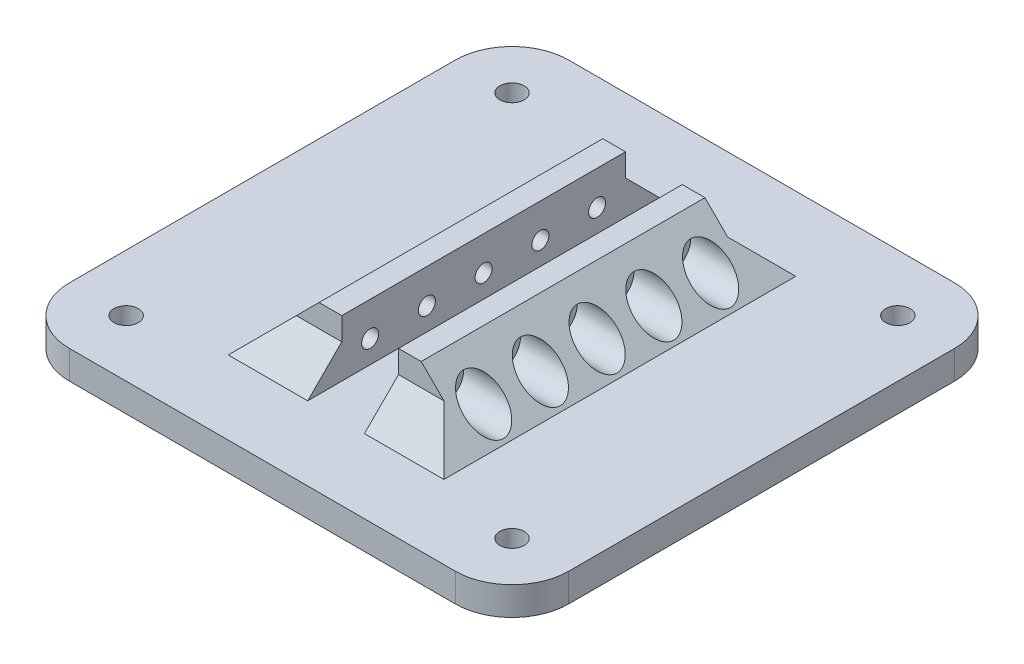
from build123d import *

# Parameters (mm, degrees)
SKETCH1_W           = 88
SKETCH1_H           = 88
BOSS_EXTRUDE1_DEPTH = 5
FILLET1_R           = 10
SKETCH2_R           = 2.15
CUT_EXTRUDE1_DEPTH  = 63.42595614
SKETCH3_W           = 4
SKETCH3_H           = 50
BOSS_EXTRUDE2_DEPTH = 10
CHAMFER1_SIZE       = 10
SKETCH4_R           = 1.5
CUT_EXTRUDE2_DEPTH  = 65.007812023
SKETCH5_R           = 3.5
CUT_EXTRUDE3_DEPTH  = 36
CUT_EXTRUDE4_START  = -36
SKETCH6_R           = 3.5
CUT_EXTRUDE4_DEPTH  = 36
LPATTERN2_COUNT     = 5
LPATTERN2_PITCH     = 10
CHAMFER2_SIZE       = 6


with BuildPart() as part:
    # Sketch1 → Boss-Extrude1 (new body)
    with BuildSketch(Plane(origin=(0, 0, 0), x_dir=(1, 0, 0), z_dir=(0, 1, 0))):
        Rectangle(SKETCH1_W, SKETCH1_H)
    extrude(amount=BOSS_EXTRUDE1_DEPTH)

    # Fillet1
    fillet1_edges = [part.edges().sort_by_distance(p)[0] for p in [
        (-44, 2.5, -44),
        (44, 2.5, -44),
        (44, 2.5, 44),
        (-44, 2.5, 44),
    ]]
    fillet(fillet1_edges, radius=FILLET1_R)

    # Sketch2 → Cut-Extrude1 (cut, through all)
    with BuildSketch(Plane(origin=(0, 5, 0), x_dir=(1, 0, 0), z_dir=(0, 1, 0))):
        with Locations(Location((34, 34, 0), (0, 0, 270))):
            Circle(SKETCH2_R)
        with Locations(Location((34, -34, 0), (0, 0, 270))):
            Circle(SKETCH2_R)
        with Locations(Location((-34, -34, 0), (0, 0, 270))):
            Circle(SKETCH2_R)
        with Locations(Location((-34, 34, 0), (0, 0, 270))):
            Circle(SKETCH2_R)
    extrude(amount=-CUT_EXTRUDE1_DEPTH, mode=Mode.SUBTRACT)

    # Sketch3 → Boss-Extrude2 (add)
    with BuildSketch(Plane(origin=(0, 5, 0), x_dir=(1, 0, 0), z_dir=(0, 1, 0))):
        with Locations((-7, 0)):
            Rectangle(SKETCH3_W, SKETCH3_H)
        with Locations((7, 0)):
            Rectangle(SKETCH3_W, SKETCH3_H)
    extrude(amount=BOSS_EXTRUDE2_DEPTH)

    # Chamfer1
    chamfer1_edges = [part.edges().sort_by_distance(p)[0] for p in [
        (9, 5, 0),
        (-9, 5, 0),
    ]]
    chamfer(chamfer1_edges, length=CHAMFER1_SIZE - 0.0001)  # a hair under: the kernel refuses the full size

    # Sketch4 → Cut-Extrude2 (cut, symmetric)
    with BuildSketch(Plane(origin=(0, 0, 0), x_dir=(0, 0, -1), z_dir=(1, 0, 0))):
        with Locations(Location((-20, 9, 0), (0, 0, 90))):
            Circle(SKETCH4_R)
    cut_extrude2 = extrude(amount=CUT_EXTRUDE2_DEPTH, both=True, mode=Mode.SUBTRACT)

    # Sketch5 → Cut-Extrude3 (cut)
    with BuildSketch(Plane(origin=(44, 0, 0), x_dir=(0, 0, -1), z_dir=(1, 0, 0))):
        with Locations((-20, 9)):
            Circle(SKETCH5_R)
    cut_extrude3 = extrude(amount=-CUT_EXTRUDE3_DEPTH, mode=Mode.SUBTRACT)

    # Sketch6 → Cut-Extrude4 (cut)
    with BuildSketch(Plane.ZY.offset(44).offset(CUT_EXTRUDE4_START)):
        with Locations(Location((20, 9, 0), (0, 0, 180))):
            Circle(SKETCH6_R)
    cut_extrude4 = extrude(amount=CUT_EXTRUDE4_DEPTH, mode=Mode.SUBTRACT)

    # LPattern2: Cut-Extrude2, Cut-Extrude3, Cut-Extrude4 ×5
    with Locations(*[(0, 0, -i * LPATTERN2_PITCH) for i in range(1, LPATTERN2_COUNT)]):
        add(cut_extrude2, mode=Mode.SUBTRACT)
        add(cut_extrude3, mode=Mode.SUBTRACT)
        add(cut_extrude4, mode=Mode.SUBTRACT)

    # Chamfer2
    chamfer2_edges = [part.edges().sort_by_distance(p)[0] for p in [
        (-11.99995, 5, -25),
        (-11.99995, 5, 25),
        (11.99995, 5, -25),
        (11.99995, 5, 25),
    ]]
    chamfer(chamfer2_edges, length=CHAMFER2_SIZE)


solid = part.part
